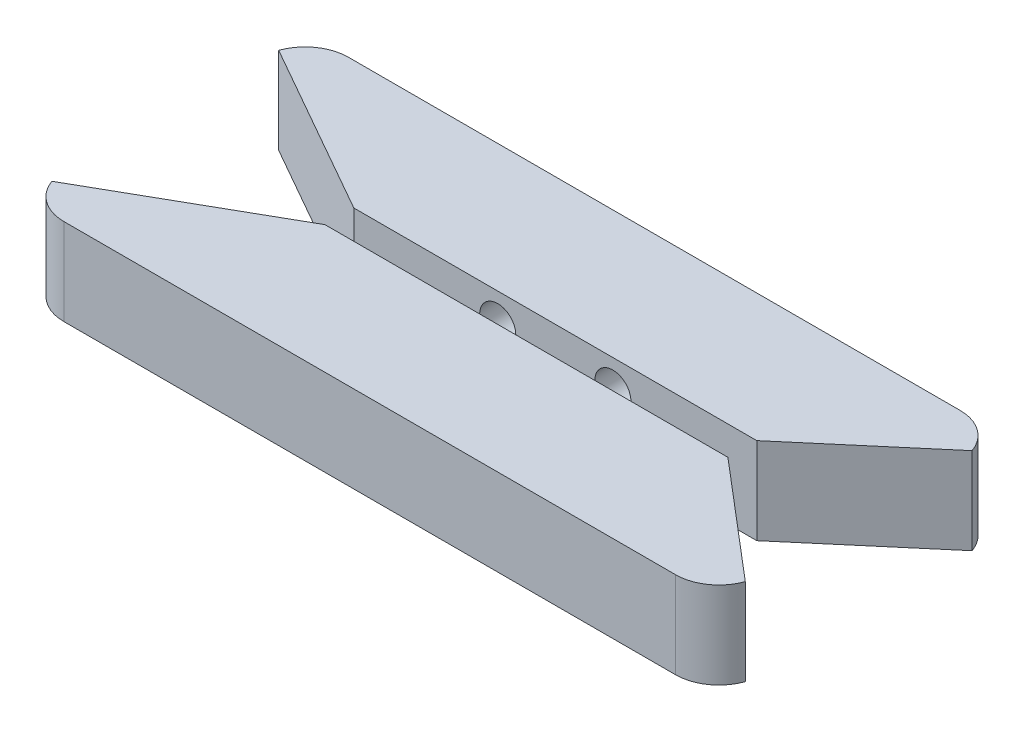
from build123d import *

# Parameters (mm, degrees)
BOSS_EXTRUDE1_DEPTH = 12
SKETCH3_R           = 2.5
CUT_EXTRUDE1_DEPTH  = 8.5
FILLET1_R           = 6


with BuildPart() as part:
    # Sketch1 → Boss-Extrude1 (new body)
    with BuildSketch(Plane(origin=(0, 0, 0), x_dir=(1, 0, 0), z_dir=(0, 1, 0))):
        Polygon((-51.995, 17.7), (44.005, 17.7), (44.005, 13.7), (27.895, 0), (-27.895, 0), (-51.995, 13.7), align=None)
    extrude(amount=BOSS_EXTRUDE1_DEPTH)

    # Sketch3 → Cut-Extrude1 (cut)
    with BuildSketch(Plane.XY):
        with Locations((-7.97, 8)):
            Circle(SKETCH3_R)
        with Locations(Location((7.97, 8, 0), (0, 0, 180))):
            Circle(SKETCH3_R)
    extrude(amount=-CUT_EXTRUDE1_DEPTH, mode=Mode.SUBTRACT)

    # Fillet1
    # the kernel refuses this fillet: 6 mm, written as the material it takes off along each edge
    with BuildSketch(Plane(origin=(44.005, -14.142135624, -17.7), x_dir=(-1, 0, 0), z_dir=(0, 1, 0))) as fillet1_piece_1:
        with BuildLine():
            CenterArc((5.656854249, 6), FILLET1_R, 199.471220634, 70.528779366)
            Line((0, 4), (-0.113137085, 3.96))
            ThreePointArc((-0.113137085, 3.96), (-0.12, 2), (-0.12, 0))
            Line((-0.12, 0), (0, -0.12))
            Line((0, -0.12), (5.656854249, -0.12))
            Line((5.656854249, -0.12), (5.656854249, 0))
        make_face()
    extrude(amount=40.284271247, mode=Mode.SUBTRACT)
    with BuildSketch(Plane(origin=(-51.995, -14.142135624, -17.7), x_dir=(1, 0, 0), z_dir=(0, 1, 0))) as fillet1_piece_2:
        with BuildLine():
            CenterArc((5.656854249, -6), FILLET1_R, 90, 70.528779366)
            Line((0, -4), (-0.113137085, -3.96))
            ThreePointArc((-0.113137085, -3.96), (-0.12, -2), (-0.12, 0))
            Line((-0.12, 0), (0, 0.12))
            Line((0, 0.12), (5.656854249, 0.12))
            Line((5.656854249, 0.12), (5.656854249, 0))
        make_face()
    extrude(amount=40.284271247, mode=Mode.SUBTRACT)


with BuildPart() as body_2:
    # Mirror1: mirrored copy
    add(part.part.mirror(Plane.XY.offset(2)))


solid = Compound([part.part, body_2.part])
